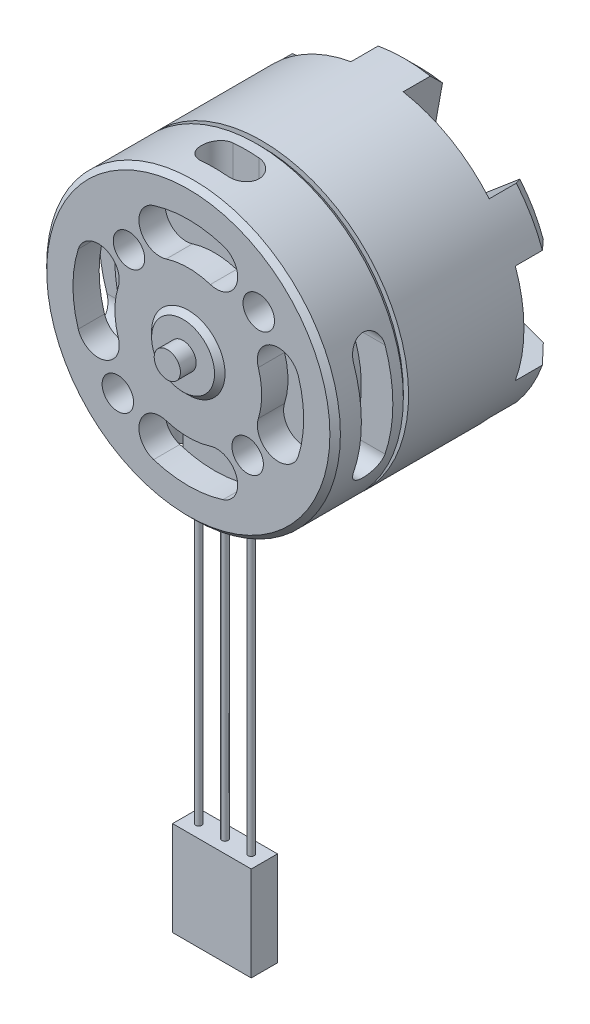
from build123d import *
from build123d.topology import SkipClean

# Parameters (mm, degrees)
SKETCH_1_R               = 14
EXTRUDE_1_DEPTH          = 7
SKETCH_2_R               = 3
EXTRUDE_2_DEPTH          = 0.5
SKETCH_3_R               = 1.25
EXTRUDE_3_DEPTH          = 1.5
CHAMFER_4_SIZE           = 0.5
SKETCH_4_R               = 1.5
CUT_EXTRUDE_2_DEPTH      = 2.5
SKETCH_5_R               = 11
SKETCH_5_R_2             = 3.5
CUT_EXTRUDE_3_DEPTH      = 1.5
CUT_EXTRUDE_5_REACH      = 34.573
CUT_EXTRUDE_5_END_RADIUS = 11
PATTERN_CIRCULAR_1_COUNT = 3
PATTERN_CIRCULAR_1_ANGLE = 180
CUT_EXTRUDE_START        = -2.9999999
CUT_EXTRUDE_6_DEPTH      = 3.9999999
CUT_EXTRUDE_START_2      = 10.650704102
CUT_EXTRUDE_6_2_DEPTH    = 0.349295998
CUT_EXTRUDE_START_3      = 1
CUT_EXTRUDE_6_3_DEPTH    = 2
EXTRUDE_START            = 11
SKETCH_8_R               = 14
EXTRUDE_4_DEPTH          = 11
SKETCH_9_R               = 12
CUT_EXTRUDE_7_DEPTH      = 11
SKETCH_10_W              = 2.07055236
SKETCH_10_H              = 4
EXTRUDE_5_DEPTH          = 0.5
EXTRUDE_6_DEPTH          = 7
EXTRUDE_7_REACH          = 34.439
EXTRUDE_7_END_RADIUS     = 12
SKETCH_13_W              = 2.07055236
SKETCH_13_H              = 4
PATTERN_CIRCULAR_4_COUNT = 12
EXTRUDE_START_2          = 1.5
EXTRUDE_8_DEPTH          = 1.5
EXTRUDE_START_3          = 2.5
EXTRUDE_9_DEPTH          = 2.5
FILLET_5_ANGLE           = 20.462778
EXTRUDE_10_DEPTH         = 1.5
SKETCH_17_R              = 3.75
EXTRUDE_11_DEPTH         = 1.8
FILLET_1_R               = 0.5
EXTRUDE_START_4          = 0.1
SKETCH_18_R              = 1.25
EXTRUDE_12_DEPTH         = 0.1
CUT_EXTRUDE_8_REACH      = 33.113
SKETCH_19_R              = 1
SKETCH_20_W              = 7
SKETCH_20_H              = 2.744265733
EXTRUDE_13_DEPTH         = 1
SKETCH_21_R              = 0.3
EXTRUDE_14_DEPTH         = 30
SKETCH_22_W              = 7.5
SKETCH_22_H              = 2.5
EXTRUDE_15_DEPTH         = 9


with BuildPart() as part:
    # 草图1 → 凸台-拉伸1 (new body)
    with BuildSketch(Plane.XY):
        Circle(SKETCH_1_R)
    extrude(amount=EXTRUDE_1_DEPTH)

    # 草图2 → 凸台-拉伸2 (add)
    with BuildSketch(Plane.XY.offset(7)):
        Circle(SKETCH_2_R)
    extrude(amount=EXTRUDE_2_DEPTH)

    # 草图3 → 凸台-拉伸3 (add)
    with BuildSketch(Plane.XY.offset(7.5)):
        Circle(SKETCH_3_R)
    extrude(amount=EXTRUDE_3_DEPTH)

    # 倒角4
    chamfer_4_edges = [part.edges().sort_by_distance(p)[0] for p in [
        (-14, 0, 0),
        (-14, 0, 7),
        (-3, 0, 7),
    ]]
    chamfer(chamfer_4_edges, length=CHAMFER_4_SIZE - 0.0001)  # a hair under: the kernel refuses the full size

    # 草图4 → 切除-拉伸2 (cut)
    with BuildSketch(Plane.XY.offset(7)):
        with Locations((-5.656854249, 5.656854249)):
            Circle(SKETCH_4_R)
        with Locations((5.656854249, -5.656854249)):
            Circle(SKETCH_4_R)
        with Locations((-6.717514421, -6.717514421)):
            Circle(SKETCH_4_R)
        with Locations((6.717514421, 6.717514421)):
            Circle(SKETCH_4_R)
        with BuildLine():
            ThreePointArc((-2.104940597, 6.676018655), (0, 7), (2.104940597, 6.676018655))
            ThreePointArc((2.104940597, 6.676018655), (4.613786097, 7.982040958), (3.307763795, 10.490886458))
            ThreePointArc((3.307763795, 10.490886458), (0, 11), (-3.307763795, 10.490886458))
            ThreePointArc((-3.307763795, 10.490886458), (-4.613786097, 7.982040958), (-2.104940597, 6.676018655))
        make_face()
        with BuildLine():
            ThreePointArc((-10.490886458, -3.307763795), (-7.982040958, -4.613786097), (-6.676018655, -2.104940597))
            ThreePointArc((-6.676018655, -2.104940597), (-7, 0), (-6.676018655, 2.104940597))
            ThreePointArc((-6.676018655, 2.104940597), (-7.982040958, 4.613786097), (-10.490886458, 3.307763795))
            ThreePointArc((-10.490886458, 3.307763795), (-11, 0), (-10.490886458, -3.307763795))
        make_face()
        with BuildLine():
            ThreePointArc((6.676018655, 2.104940597), (7, 0), (6.676018655, -2.104940597))
            ThreePointArc((6.676018655, -2.104940597), (7.982040958, -4.613786097), (10.490886458, -3.307763795))
            ThreePointArc((10.490886458, -3.307763795), (11, 0), (10.490886458, 3.307763795))
            ThreePointArc((10.490886458, 3.307763795), (7.982040958, 4.613786097), (6.676018655, 2.104940597))
        make_face()
        with BuildLine():
            ThreePointArc((2.104940597, -6.676018655), (0, -7), (-2.104940597, -6.676018655))
            ThreePointArc((-2.104940597, -6.676018655), (-4.613786097, -7.982040958), (-3.307763795, -10.490886458))
            ThreePointArc((-3.307763795, -10.490886458), (0, -11), (3.307763795, -10.490886458))
            ThreePointArc((3.307763795, -10.490886458), (4.613786097, -7.982040958), (2.104940597, -6.676018655))
        make_face()
    extrude(amount=-CUT_EXTRUDE_2_DEPTH, mode=Mode.SUBTRACT)

    # 草图5 → 切除-拉伸3 (cut)
    with BuildSketch(Plane.XY.offset(4.5)):
        Circle(SKETCH_5_R)
        Circle(SKETCH_5_R_2, mode=Mode.SUBTRACT)
    extrude(amount=-CUT_EXTRUDE_3_DEPTH, mode=Mode.SUBTRACT)

    # 切除-拉伸5: up to this cylinder (the profile starts outside it)
    cut_extrude_5_end = Plane(origin=(0, 0, 3), z_dir=(0, 0, 1)) * Cylinder(CUT_EXTRUDE_5_END_RADIUS, 92.146, mode=Mode.PRIVATE)
    # 草图6 → 切除-拉伸5 (cut, up to the surface)
    with BuildSketch(Plane.ZY.offset(14), mode=Mode.PRIVATE) as cut_extrude_5_sk1:
        with BuildLine():
            Line((1.5, -4.5), (1.5, 4.5))
            ThreePointArc((1.5, 4.5), (3, 6), (4.5, 4.5))
            Line((4.5, 4.5), (4.5, -4.5))
            ThreePointArc((4.5, -4.5), (3, -6), (1.5, -4.5))
        make_face()
    cut_extrude_5_tool1 = extrude(cut_extrude_5_sk1.sketch, amount=-CUT_EXTRUDE_5_REACH, mode=Mode.PRIVATE) - cut_extrude_5_end
    cut_extrude_5 = cut_extrude_5_tool1.solids().sort_by_distance((-14, 0, 3))[0]
    add(cut_extrude_5, mode=Mode.SUBTRACT)

    # 阵列(圆周)1: 切除-拉伸5 ×3 about axis
    with SkipClean():  # the faces are left unmerged after this step: merging them gives an invalid solid
        pattern_circular_1_axis = Axis((0, 0, 0), (0, 0, 1))
        for i in range(1, PATTERN_CIRCULAR_1_COUNT):
            add(cut_extrude_5.rotate(pattern_circular_1_axis, i * PATTERN_CIRCULAR_1_ANGLE / (PATTERN_CIRCULAR_1_COUNT - 1)), mode=Mode.SUBTRACT)

    # 切除-拉伸6: read off the stored shape, not the designer's step
    # 切除-拉伸6 outline → 切除-拉伸6 (cut)
    with BuildSketch(Plane(origin=(0, 14, 0), x_dir=(1, 0, 0), z_dir=(0, 1, 0)).offset(CUT_EXTRUDE_START)):
        with BuildLine():
            ThreePointArc((-1.25, -1.5), (-2.75, -3), (-1.25, -4.5))
            Line((-1.25, -4.5), (1.25, -4.5))
            ThreePointArc((1.25, -4.5), (2.75, -3), (1.25, -1.5))
            Line((1.25, -1.5), (-1.25, -1.5))
        make_face()
    extrude(amount=CUT_EXTRUDE_6_DEPTH, mode=Mode.SUBTRACT)

    # Cut-Extrude 6 2 outline → Cut-Extrude 6 2 (cut)
    with BuildSketch(Plane(origin=(0, 0, 0), x_dir=(1, 0, 0), z_dir=(0, 1, 0)).offset(CUT_EXTRUDE_START_2)):
        with BuildLine():
            Line((1.25, -1.5), (-1.25, -1.5))
            ThreePointArc((-1.25, -1.5), (-2.75, -3), (-1.25, -4.5))
            Line((-1.25, -4.5), (1.25, -4.5))
            ThreePointArc((1.25, -4.5), (2.75, -3), (1.25, -1.5))
        make_face()
    extrude(amount=CUT_EXTRUDE_6_2_DEPTH, mode=Mode.SUBTRACT)

    # Cut-Extrude 6 3 outline → Cut-Extrude 6 3 (add)
    with BuildSketch(Plane.XY.offset(CUT_EXTRUDE_START_3)):
        with BuildLine():
            Line((-2.75, 10.650704202), (2.75, 10.650704202))
            ThreePointArc((2.75, 10.650704202), (0, 11), (-2.75, 10.650704202))
        make_face()
    extrude(amount=CUT_EXTRUDE_6_3_DEPTH)

    # 草图8 → 凸台-拉伸4 (add)
    with BuildSketch(Plane(origin=(0, 0, 0), x_dir=(-1, 0, 0), z_dir=(0, 0, -1)).offset(EXTRUDE_START)):
        with Locations(Location((0, 0, 0), (0, 0, 180))):
            Circle(SKETCH_8_R)
    extrude(amount=-EXTRUDE_4_DEPTH)

    # 草图9 → 切除-拉伸7 (cut)
    with BuildSketch(Plane(origin=(0, 0, -11), x_dir=(-1, 0, 0), z_dir=(0, 0, -1))):
        Circle(SKETCH_9_R)
        Polygon((3.980163493, 0.397867531), (3.24798893, 2.334645135), (1.645518357, 3.645856461), (-0.397867531, 3.980163493), (-2.334645135, 3.24798893), (-3.645856461, 1.645518357), (-3.980163493, -0.397867531), (-3.24798893, -2.334645135), (-1.645518357, -3.645856461), (0.397867531, -3.980163493), (2.334645135, -3.24798893), (3.645856461, -1.645518357), align=None, mode=Mode.SUBTRACT)
    extrude(amount=-CUT_EXTRUDE_7_DEPTH, mode=Mode.SUBTRACT)

    # 草图10 → 凸台-拉伸5 (add)
    with BuildSketch(Plane(origin=(-1.366256333, -3.614076212, 0), x_dir=(0.9353917539957333, -0.35361315947909205, 0), z_dir=(-0.353613159479092, -0.9353917539957332, 0))):
        with Locations((0, -6)):
            Rectangle(SKETCH_10_W, SKETCH_10_H)
    extrude_5 = extrude(amount=EXTRUDE_5_DEPTH)

    # 草图11 → 凸台-拉伸6 (add)
    with BuildSketch(Plane(origin=(-1.543062913, -4.081772089, 0), x_dir=(0.9353917539957332, -0.3536131594790921, 0), z_dir=(-0.3536131594790921, -0.9353917539957333, 0))):
        with BuildLine():
            Line((0.2, -7.5), (-0.2, -7.5))
            ThreePointArc((-0.2, -7.5), (-0.553553391, -7.353553391), (-0.7, -7))
            Line((-0.7, -7), (-0.7, -5))
            ThreePointArc((-0.7, -5), (-0.553553391, -4.646446609), (-0.2, -4.5))
            Line((-0.2, -4.5), (0.2, -4.5))
            ThreePointArc((0.2, -4.5), (0.553553391, -4.646446609), (0.7, -5))
            Line((0.7, -5), (0.7, -7))
            ThreePointArc((0.7, -7), (0.553553391, -7.353553391), (0.2, -7.5))
        make_face()
    extrude_6 = extrude(amount=EXTRUDE_6_DEPTH)

    # 凸台-拉伸7: up to this cylinder (the profile starts inside it)
    extrude_7_end = Plane(origin=(0, 0, -6), z_dir=(0, 0, -1)) * Cylinder(EXTRUDE_7_END_RADIUS, 93.878, mode=Mode.PRIVATE)
    # 草图13 → 凸台-拉伸7 (add, up to the surface)
    with BuildSketch(Plane(origin=(-4.018355029, -10.629514366, 0), x_dir=(0.9353917539957332, -0.35361315947909217, 0), z_dir=(-0.35361315947909217, -0.9353917539957333, 0)), mode=Mode.PRIVATE) as extrude_7_sk1:
        with Locations((0, -6)):
            Rectangle(SKETCH_13_W, SKETCH_13_H)
    extrude_7_tool1 = extrude(extrude_7_sk1.sketch, amount=EXTRUDE_7_REACH, mode=Mode.PRIVATE) & extrude_7_end
    extrude_7 = extrude_7_tool1.solids().sort_by_distance((-4.018355, -10.629514, -6))[0]
    add(extrude_7)

    # 阵列(圆周)4: 凸台-拉伸5, 凸台-拉伸6, 凸台-拉伸7 ×12 about axis
    pattern_circular_4_axis = Axis((0, 0, 0), (0, 0, 1))
    add([extrude_5.rotate(pattern_circular_4_axis, i * 360 / PATTERN_CIRCULAR_4_COUNT) for i in range(1, PATTERN_CIRCULAR_4_COUNT)])
    add([extrude_6.rotate(pattern_circular_4_axis, i * 360 / PATTERN_CIRCULAR_4_COUNT) for i in range(1, PATTERN_CIRCULAR_4_COUNT)])
    add([extrude_7.rotate(pattern_circular_4_axis, i * 360 / PATTERN_CIRCULAR_4_COUNT) for i in range(1, PATTERN_CIRCULAR_4_COUNT)])

    # 草图14 → 凸台-拉伸8 (add)
    with SkipClean():  # the faces are left unmerged after this step: merging them gives an invalid solid
        with BuildSketch(Plane(origin=(0, 0, -11), x_dir=(-1, 0, 0), z_dir=(0, 0, -1)).offset(EXTRUDE_START_2)):
            with BuildLine():
                Line((2.486734603, -13.777378234), (2.131486803, -11.809181344))
                ThreePointArc((2.131486803, -11.809181344), (0, -12), (-2.131486803, -11.809181344))
                Line((-2.131486803, -11.809181344), (-2.486734603, -13.777378234))
                ThreePointArc((-2.486734603, -13.777378234), (0, -14), (2.486734603, -13.777378234))
            make_face()
            with BuildLine():
                Line((-10.688192247, -9.042264456), (-9.16130764, -7.750512391))
                ThreePointArc((-9.16130764, -7.750512391), (-10.392304845, -6), (-11.292794443, -4.058668953))
                Line((-11.292794443, -4.058668953), (-13.17492685, -4.735113778))
                ThreePointArc((-13.17492685, -4.735113778), (-12.124355653, -7), (-10.688192247, -9.042264456))
            make_face()
            with BuildLine():
                Line((-13.17492685, 4.735113778), (-11.292794443, 4.058668953))
                ThreePointArc((-11.292794443, 4.058668953), (-10.392304845, 6), (-9.16130764, 7.750512391))
                Line((-9.16130764, 7.750512391), (-10.688192247, 9.042264456))
                ThreePointArc((-10.688192247, 9.042264456), (-12.124355653, 7), (-13.17492685, 4.735113778))
            make_face()
            with BuildLine():
                Line((-2.486734603, 13.777378234), (-2.131486803, 11.809181344))
                ThreePointArc((-2.131486803, 11.809181344), (0, 12), (2.131486803, 11.809181344))
                Line((2.131486803, 11.809181344), (2.486734603, 13.777378234))
                ThreePointArc((2.486734603, 13.777378234), (0, 14), (-2.486734603, 13.777378234))
            make_face()
            with BuildLine():
                Line((10.688192247, 9.042264456), (9.16130764, 7.750512391))
                ThreePointArc((9.16130764, 7.750512391), (10.392304845, 6), (11.292794443, 4.058668953))
                Line((11.292794443, 4.058668953), (13.17492685, 4.735113778))
                ThreePointArc((13.17492685, 4.735113778), (12.124355653, 7), (10.688192247, 9.042264456))
            make_face()
            with BuildLine():
                Line((13.17492685, -4.735113778), (11.292794443, -4.058668953))
                ThreePointArc((11.292794443, -4.058668953), (10.392304845, -6), (9.16130764, -7.750512391))
                Line((9.16130764, -7.750512391), (10.688192247, -9.042264456))
                ThreePointArc((10.688192247, -9.042264456), (12.124355653, -7), (13.17492685, -4.735113778))
            make_face()
        extrude(amount=-EXTRUDE_8_DEPTH)

    # 草图15 → 凸台-拉伸9 (add)
    with SkipClean():  # the faces are left unmerged after this step: merging them gives an invalid solid
        with BuildSketch(Plane(origin=(0, 0, -12.5), x_dir=(-1, 0, 0), z_dir=(0, 0, -1)).offset(EXTRUDE_START_3)):
            with BuildLine():
                Line((10.688192247, 9.042264456), (5.801659219, 4.908232911))
                ThreePointArc((5.801659219, 4.908232911), (4.375998287, 4.323995317), (2.878541282, 4.686576585))
                ThreePointArc((2.878541282, 4.686576585), (2.75, 4.763139721), (2.619423738, 4.836178169))
                ThreePointArc((2.619423738, 4.836178169), (1.556690646, 5.951723342), (1.349824779, 7.478500723))
                Line((1.349824779, 7.478500723), (2.486734603, 13.777378234))
                ThreePointArc((2.486734603, 13.777378234), (0, 14), (-2.486734603, 13.777378234))
                Line((-2.486734603, 13.777378234), (-1.349824779, 7.478500723))
                ThreePointArc((-1.349824779, 7.478500723), (-1.556690646, 5.951723342), (-2.619423738, 4.836178169))
                ThreePointArc((-2.619423738, 4.836178169), (-2.75, 4.763139721), (-2.878541282, 4.686576585))
                ThreePointArc((-2.878541282, 4.686576585), (-4.375998287, 4.323995317), (-5.801659219, 4.908232911))
                Line((-5.801659219, 4.908232911), (-10.688192247, 9.042264456))
                ThreePointArc((-10.688192247, 9.042264456), (-12.124355653, 7), (-13.17492685, 4.735113778))
                Line((-13.17492685, 4.735113778), (-7.151483998, 2.570267812))
                ThreePointArc((-7.151483998, 2.570267812), (-5.932688934, 1.627728025), (-5.49796502, 0.149601584))
                ThreePointArc((-5.49796502, 0.149601584), (-5.5, 0), (-5.49796502, -0.149601584))
                ThreePointArc((-5.49796502, -0.149601584), (-5.932688934, -1.627728025), (-7.151483998, -2.570267812))
                Line((-7.151483998, -2.570267812), (-13.17492685, -4.735113778))
                ThreePointArc((-13.17492685, -4.735113778), (-12.124355653, -7), (-10.688192247, -9.042264456))
                Line((-10.688192247, -9.042264456), (-5.801659219, -4.908232911))
                ThreePointArc((-5.801659219, -4.908232911), (-4.375998287, -4.323995317), (-2.878541282, -4.686576585))
                ThreePointArc((-2.878541282, -4.686576585), (-2.75, -4.763139721), (-2.619423738, -4.836178169))
                ThreePointArc((-2.619423738, -4.836178169), (-1.556690646, -5.951723342), (-1.349824779, -7.478500723))
                Line((-1.349824779, -7.478500723), (-2.486734603, -13.777378234))
                ThreePointArc((-2.486734603, -13.777378234), (0, -14), (2.486734603, -13.777378234))
                Line((2.486734603, -13.777378234), (1.349824779, -7.478500723))
                ThreePointArc((1.349824779, -7.478500723), (1.556690646, -5.951723342), (2.619423738, -4.836178169))
                ThreePointArc((2.619423738, -4.836178169), (2.75, -4.763139721), (2.878541282, -4.686576585))
                ThreePointArc((2.878541282, -4.686576585), (4.375998287, -4.323995317), (5.801659219, -4.908232911))
                Line((5.801659219, -4.908232911), (10.688192247, -9.042264456))
                ThreePointArc((10.688192247, -9.042264456), (12.124355653, -7), (13.17492685, -4.735113778))
                Line((13.17492685, -4.735113778), (7.151483998, -2.570267812))
                ThreePointArc((7.151483998, -2.570267812), (5.932688934, -1.627728025), (5.49796502, -0.149601584))
                ThreePointArc((5.49796502, -0.149601584), (5.5, 0), (5.49796502, 0.149601584))
                ThreePointArc((5.49796502, 0.149601584), (5.932688934, 1.627728025), (7.151483998, 2.570267812))
                Line((7.151483998, 2.570267812), (13.17492685, 4.735113778))
                ThreePointArc((13.17492685, 4.735113778), (12.124355653, 7), (10.688192247, 9.042264456))
            make_face()
        extrude(amount=-EXTRUDE_9_DEPTH)

    # 倒角5: read off the stored shape, not the designer's step
    # 倒角5 outline → 倒角5 (revolve, cut)
    with SkipClean():  # the faces are left unmerged after this step: merging them gives an invalid solid
        with BuildSketch(Plane(origin=(0, 0, 0), x_dir=(-0.7634423033500252, 0.6458760325756082, 0), z_dir=(0.6458760325756082, 0.7634423033500252, 0))):
            Polygon((14, -13.585786438), (12.585786438, -15), (14, -15), align=None)
        revolve(axis=Axis((0, 0, 0), (0, 0, 1)), revolution_arc=FILLET_5_ANGLE, mode=Mode.SUBTRACT)

    # 阵列(圆周)5: read off the stored shape, not the designer's step
    # 阵列(圆周)5 outline → 阵列(圆周)5 (revolve, cut)
    with SkipClean():  # the faces are left unmerged after this step: merging them gives an invalid solid
        with BuildSketch(Plane.XZ):
            Polygon((14, -13.585786438), (12.585786438, -15), (14, -15), align=None)
        revolve(axis=Axis((0, 0, 0), (0, 0, 1)), mode=Mode.SUBTRACT)

    # 草图16 → 凸台-拉伸10 (add)
    with SkipClean():  # the faces are left unmerged after this step: merging them gives an invalid solid
        with BuildSketch(Plane(origin=(0, 0, -11), x_dir=(-1, 0, 0), z_dir=(0, 0, -1))):
            Polygon((-3.24798893, -2.334645135), (-1.645518357, -3.645856461), (0.397867531, -3.980163493), (2.334645135, -3.24798893), (3.645856461, -1.645518357), (3.980163493, 0.397867531), (3.24798893, 2.334645135), (1.645518357, 3.645856461), (-0.397867531, 3.980163493), (-2.334645135, 3.24798893), (-3.645856461, 1.645518357), (-3.980163493, -0.397867531), align=None)
        extrude(amount=EXTRUDE_10_DEPTH)

    # 草图17 → 凸台-拉伸11 (add)
    with SkipClean():  # the faces are left unmerged after this step: merging them gives an invalid solid
        with BuildSketch(Plane(origin=(0, 0, -15), x_dir=(-1, 0, 0), z_dir=(0, 0, -1))):
            Circle(SKETCH_17_R)
        extrude(amount=EXTRUDE_11_DEPTH)

    # 圆角1
    fillet_1_edges = [part.edges().sort_by_distance(p)[0] for p in [
        (3.75, 0, -16.8),
    ]]
    fillet(fillet_1_edges, radius=FILLET_1_R)

    # 草图18 → 凸台-拉伸12 (add)
    with BuildSketch(Plane(origin=(0, 0, -16.8), x_dir=(-1, 0, 0), z_dir=(0, 0, -1)).offset(EXTRUDE_START_4)):
        with Locations(Location((0, 0, 0), (0, 0, 180))):
            Circle(SKETCH_18_R)
    extrude(amount=-EXTRUDE_12_DEPTH)

    # 草图19 → 切除-拉伸8 (cut, up to next)
    with BuildSketch(Plane(origin=(0, 0, -15), x_dir=(-1, 0, 0), z_dir=(0, 0, -1)), mode=Mode.PRIVATE) as cut_extrude_8_sk1:
        with Locations((0, 5)):
            Circle(SKETCH_19_R)
    cut_extrude_8_tool1 = extrude(cut_extrude_8_sk1.sketch, amount=-CUT_EXTRUDE_8_REACH, mode=Mode.PRIVATE) & part.part
    # 草图19 → 切除-拉伸8 (cut, up to next)
    with BuildSketch(Plane(origin=(0, 0, -15), x_dir=(-1, 0, 0), z_dir=(0, 0, -1)), mode=Mode.PRIVATE) as cut_extrude_8_sk2:
        with Locations((4.330127019, -2.5)):
            Circle(SKETCH_19_R)
    cut_extrude_8_tool2 = extrude(cut_extrude_8_sk2.sketch, amount=-CUT_EXTRUDE_8_REACH, mode=Mode.PRIVATE) & part.part
    # 草图19 → 切除-拉伸8 (cut, up to next)
    with BuildSketch(Plane(origin=(0, 0, -15), x_dir=(-1, 0, 0), z_dir=(0, 0, -1)), mode=Mode.PRIVATE) as cut_extrude_8_sk3:
        with Locations((-4.330127019, -2.5)):
            Circle(SKETCH_19_R)
    cut_extrude_8_tool3 = extrude(cut_extrude_8_sk3.sketch, amount=-CUT_EXTRUDE_8_REACH, mode=Mode.PRIVATE) & part.part
    add(cut_extrude_8_tool1.solids().sort_by_distance((0, 5, -15))[0], mode=Mode.SUBTRACT)
    add(cut_extrude_8_tool2.solids().sort_by_distance((-4.330127, -2.5, -15))[0], mode=Mode.SUBTRACT)
    add(cut_extrude_8_tool3.solids().sort_by_distance((4.330127, -2.5, -15))[0], mode=Mode.SUBTRACT)

    # 草图20 → 凸台-拉伸13 (add)
    with BuildSketch(Plane.XY.offset(3)):
        with Locations((0, -10.515190399)):
            Rectangle(SKETCH_20_W, SKETCH_20_H)
    extrude(amount=EXTRUDE_13_DEPTH)

    # 草图21 → 凸台-拉伸14 (add)
    with BuildSketch(Plane.XZ.offset(11.887323266)):
        with Locations(Location((0, 3.5, 0), (0, 0, 90))):
            Circle(SKETCH_21_R)
        with Locations(Location((-2.5, 3.5, 0), (0, 0, 90))):
            Circle(SKETCH_21_R)
        with Locations(Location((2.5, 3.5, 0), (0, 0, 90))):
            Circle(SKETCH_21_R)
    extrude(amount=EXTRUDE_14_DEPTH)

    # 草图22 → 凸台-拉伸15 (add)
    with SkipClean():  # the faces are left unmerged after this step: merging them gives an invalid solid
        with BuildSketch(Plane.XZ.offset(41.887323266)):
            with Locations((0, 3.5)):
                Rectangle(SKETCH_22_W, SKETCH_22_H)
        extrude(amount=EXTRUDE_15_DEPTH)


solid = part.part
